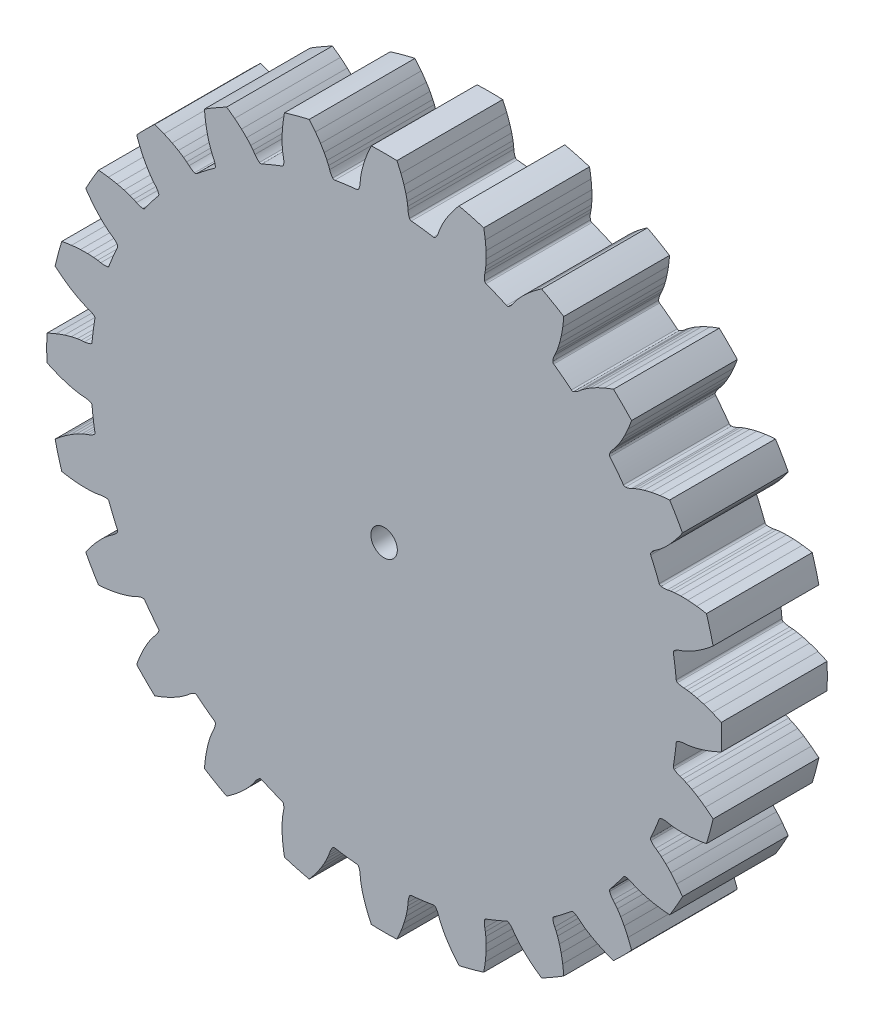
from build123d import *

# Parameters (mm, degrees)
BOSS_EXTRUDE1_DEPTH = 12.7
SKETCH2_R           = 1.5875
CUT_EXTRUDE1_DEPTH  = 59.67273613


with BuildPart() as part:
    # Model → Boss-Extrude1 (new body)
    with BuildSketch(Plane.XY):
        with BuildLine():
            ThreePointArc((34.918122358, -4.597058019), (34.999024317, -3.934019352), (35.067337394, -3.269565647))
            ThreePointArc((35.067337394, -3.269565647), (35.117289307, -3.136889034), (35.227836474, -3.048133181))
            ThreePointArc((35.227836474, -3.048133181), (35.597586296, -2.925959175), (35.983262257, -2.872149586))
            ThreePointArc((35.983262257, -2.872149586), (36.173696873, -2.859616768), (36.363582299, -2.840487209))
            ThreePointArc((36.363582299, -2.840487209), (36.599053851, -2.809299698), (36.833565008, -2.771563378))
            ThreePointArc((36.833565008, -2.771563378), (37.195949989, -2.701153106), (37.555494844, -2.617439436))
            ThreePointArc((37.555494844, -2.617439436), (37.966482977, -2.506715419), (38.373723351, -2.382915857))
            ThreePointArc((38.373723351, -2.382915857), (38.883469202, -2.208794801), (39.386594794, -2.016379586))
            ThreePointArc((39.386594794, -2.016379586), (39.934832511, -1.784794144), (40.475208291, -1.535414057))
            ThreePointArc((40.475208291, -1.535414057), (40.504320541, 0), (40.475208291, 1.535414057))
            ThreePointArc((40.475208291, 1.535414057), (39.934832515, 1.784794142), (39.386594803, 2.016379583))
            ThreePointArc((39.386594803, 2.016379583), (38.883469215, 2.208794797), (38.373723367, 2.382915852))
            ThreePointArc((38.373723367, 2.382915852), (37.966482996, 2.506715414), (37.555494865, 2.617439431))
            ThreePointArc((37.555494865, 2.617439431), (37.195950011, 2.701153102), (36.83356503, 2.771563374))
            ThreePointArc((36.83356503, 2.771563374), (36.599053872, 2.809299694), (36.363582319, 2.840487206))
            ThreePointArc((36.363582319, 2.840487206), (36.173696892, 2.859616766), (35.983262273, 2.872149585))
            ThreePointArc((35.983262273, 2.872149585), (35.597586321, 2.925959167), (35.227836504, 3.048133159))
            ThreePointArc((35.227836504, 3.048133159), (35.117289331, 3.136889003), (35.067337397, 3.269565608))
            ThreePointArc((35.067337397, 3.269565608), (34.91812236, 4.597058), (34.718672707, 5.917936879))
            ThreePointArc((34.718672707, 5.917936879), (34.732583315, 6.059021153), (34.816391973, 6.173364435))
            ThreePointArc((34.816391973, 6.173364435), (35.141921916, 6.38707376), (35.500529341, 6.538870115))
            ThreePointArc((35.500529341, 6.538870115), (35.681231323, 6.600263994), (35.859695466, 6.667887693))
            ThreePointArc((35.859695466, 6.667887693), (36.079071597, 6.758957038), (36.295825102, 6.856103477))
            ThreePointArc((36.295825102, 6.856103477), (36.627638596, 7.017906712), (36.953265565, 7.191824964))
            ThreePointArc((36.953265565, 7.191824964), (37.321592132, 7.405147707), (37.682914442, 7.630130466))
            ThreePointArc((37.682914442, 7.630130466), (38.13022528, 7.930250426), (38.56640656, 8.246327736))
            ThreePointArc((38.56640656, 8.246327736), (39.036024807, 8.611916458), (39.493443412, 8.992658669))
            ThreePointArc((39.493443412, 8.992658669), (39.124169287, 10.483289565), (38.698654612, 11.958850852))
            ThreePointArc((38.698654612, 11.958850852), (38.112147379, 12.059873974), (37.522651691, 12.141673971))
            ThreePointArc((37.522651691, 12.141673971), (36.986868971, 12.197314312), (36.449426446, 12.233570402))
            ThreePointArc((36.449426446, 12.233570402), (36.024020769, 12.247750032), (35.598379235, 12.248329665))
            ThreePointArc((35.598379235, 12.248329665), (35.229418882, 12.236133805), (34.861158351, 12.210352771))
            ThreePointArc((34.861158351, 12.210352771), (34.624871089, 12.186107303), (34.389351112, 12.155287604))
            ThreePointArc((34.389351112, 12.155287604), (34.20098478, 12.124619375), (34.013795331, 12.087437043))
            ThreePointArc((34.013795331, 12.087437043), (33.627334023, 12.039592826), (33.23856217, 12.061905546))
            ThreePointArc((33.23856217, 12.061905546), (33.108810098, 12.119025393), (33.026221003, 12.234252641))
            ThreePointArc((33.026221003, 12.234252641), (32.538510031, 13.477892133), (32.00398785, 14.702141787))
            ThreePointArc((32.00398785, 14.702141787), (31.980909169, 14.842019062), (32.032267897, 14.974157468))
            ThreePointArc((32.032267897, 14.974157468), (32.291393633, 15.264838172), (32.598494018, 15.504276623))
            ThreePointArc((32.598494018, 15.504276623), (32.757148825, 15.610347671), (32.912029648, 15.721857067))
            ThreePointArc((32.912029648, 15.721857067), (33.100360238, 15.86660202), (33.284584698, 16.01653821))
            ThreePointArc((33.284584698, 16.01653821), (33.563214162, 16.258707785), (33.832732305, 16.510978377))
            ThreePointArc((33.832732305, 16.510978377), (34.13329646, 16.812362255), (34.424077188, 17.123196008))
            ThreePointArc((34.424077188, 17.123196008), (34.778469517, 17.528862191), (35.117981453, 17.947061451))
            ThreePointArc((35.117981453, 17.947061451), (35.476976522, 18.421739186), (35.820265632, 18.907896567))
            ThreePointArc((35.820265632, 18.907896567), (35.077770552, 20.252160271), (34.284851575, 21.567311724))
            ThreePointArc((34.284851575, 21.567311724), (33.692182383, 21.513093325), (33.101601876, 21.439533344))
            ThreePointArc((33.101601876, 21.439533344), (32.569674729, 21.354607013), (32.041161348, 21.250527346))
            ThreePointArc((32.041161348, 21.250527346), (31.62658106, 21.154120727), (31.215292889, 21.044516473))
            ThreePointArc((31.215292889, 21.044516473), (30.862061076, 20.937242211), (30.513021341, 20.817026805))
            ThreePointArc((30.513021341, 20.817026805), (30.291060561, 20.732451838), (30.071542458, 20.64172524))
            ThreePointArc((30.071542458, 20.64172524), (29.897532074, 20.56334921), (29.726344447, 20.478985641))
            ThreePointArc((29.726344447, 20.478985641), (29.365434484, 20.33274813), (28.984134754, 20.253679002))
            ThreePointArc((28.984134754, 20.253679002), (28.844020171, 20.275270231), (28.734422225, 20.365195575))
            ThreePointArc((28.734422225, 20.365195575), (27.941452016, 21.440230191), (27.10828411, 22.484420029))
            ThreePointArc((27.10828411, 22.484420029), (27.049788913, 22.613557898), (27.065197699, 22.754486415))
            ThreePointArc((27.065197699, 22.754486415), (27.240260237, 23.10232909), (27.4749252, 23.413092302))
            ThreePointArc((27.4749252, 23.413092302), (27.600720768, 23.556611952), (27.721463399, 23.704407864))
            ThreePointArc((27.721463399, 23.704407864), (27.865914029, 23.892964296), (28.005054851, 24.085472333))
            ThreePointArc((28.005054851, 24.085472333), (28.211512149, 24.391504792), (28.40655425, 24.7049359))
            ThreePointArc((28.40655425, 24.7049359), (28.618873042, 25.073842099), (28.819295962, 25.449344039))
            ThreePointArc((28.819295962, 25.449344039), (29.056618531, 25.932910967), (29.276323945, 26.424732587))
            ThreePointArc((29.276323945, 26.424732587), (29.500230916, 26.976150832), (29.705995944, 27.534592561))
            ThreePointArc((29.705995944, 27.534592561), (28.640879722, 28.640879722), (27.534592561, 29.705995944))
            ThreePointArc((27.534592561, 29.705995944), (26.976150836, 29.500230918), (26.424732596, 29.276323949))
            ThreePointArc((26.424732596, 29.276323949), (25.932910979, 29.056618537), (25.449344054, 28.81929597))
            ThreePointArc((25.449344054, 28.81929597), (25.073842116, 28.618873052), (24.704935918, 28.406554261))
            ThreePointArc((24.704935918, 28.406554261), (24.39150481, 28.211512161), (24.085472352, 28.005054864))
            ThreePointArc((24.085472352, 28.005054864), (23.892964314, 27.865914042), (23.704407881, 27.721463412))
            ThreePointArc((23.704407881, 27.721463412), (23.556611966, 27.60072078), (23.413092315, 27.474925211))
            ThreePointArc((23.413092315, 27.474925211), (23.102329113, 27.24026025), (22.754486452, 27.065197706))
            ThreePointArc((22.754486452, 27.065197706), (22.613557937, 27.049788908), (22.484420059, 27.108284085))
            ThreePointArc((22.484420059, 27.108284085), (21.440230222, 27.941451993), (20.365195606, 28.734422203))
            ThreePointArc((20.365195606, 28.734422203), (20.275270245, 28.844020135), (20.253679006, 28.984134716))
            ThreePointArc((20.253679006, 28.984134716), (20.332748124, 29.365434458), (20.478985633, 29.726344432))
            ThreePointArc((20.478985633, 29.726344432), (20.563349202, 29.897532057), (20.641725231, 30.071542439))
            ThreePointArc((20.641725231, 30.071542439), (20.73245183, 30.29106054), (20.817026797, 30.51302132))
            ThreePointArc((20.817026797, 30.51302132), (20.937242204, 30.862061055), (21.044516467, 31.215292869))
            ThreePointArc((21.044516467, 31.215292869), (21.154120722, 31.626581041), (21.250527343, 32.041161331))
            ThreePointArc((21.250527343, 32.041161331), (21.354607011, 32.569674716), (21.439533342, 33.101601867))
            ThreePointArc((21.439533342, 33.101601867), (21.513093325, 33.692182378), (21.567311724, 34.284851575))
            ThreePointArc((21.567311724, 34.284851575), (20.252160271, 35.077770552), (18.907896567, 35.820265632))
            ThreePointArc((18.907896567, 35.820265632), (18.42173919, 35.476976525), (17.947061459, 35.117981459))
            ThreePointArc((17.947061459, 35.117981459), (17.528862202, 34.778469526), (17.123196021, 34.4240772))
            ThreePointArc((17.123196021, 34.4240772), (16.812362269, 34.133296474), (16.510978392, 33.83273232))
            ThreePointArc((16.510978392, 33.83273232), (16.2587078, 33.563214178), (16.016538225, 33.284584715))
            ThreePointArc((16.016538225, 33.284584715), (15.866602034, 33.100360255), (15.72185708, 32.912029664))
            ThreePointArc((15.72185708, 32.912029664), (15.610347682, 32.75714884), (15.504276633, 32.598494032))
            ThreePointArc((15.504276633, 32.598494032), (15.264838191, 32.291393651), (14.974157502, 32.032267913))
            ThreePointArc((14.974157502, 32.032267913), (14.8420191, 31.980909174), (14.702141823, 32.003987833))
            ThreePointArc((14.702141823, 32.003987833), (13.477892169, 32.538510016), (12.234252678, 33.026220989))
            ThreePointArc((12.234252678, 33.026220989), (12.119025417, 33.108810067), (12.061905559, 33.238562135))
            ThreePointArc((12.061905559, 33.238562135), (12.039592826, 33.627333997), (12.087437039, 34.013795315))
            ThreePointArc((12.087437039, 34.013795315), (12.124619372, 34.200984761), (12.155287601, 34.389351092))
            ThreePointArc((12.155287601, 34.389351092), (12.186107301, 34.624871067), (12.210352769, 34.861158328))
            ThreePointArc((12.210352769, 34.861158328), (12.236133804, 35.22941886), (12.248329664, 35.598379214))
            ThreePointArc((12.248329664, 35.598379214), (12.247750033, 36.02402075), (12.233570403, 36.449426428))
            ThreePointArc((12.233570403, 36.449426428), (12.197314313, 36.986868957), (12.141673972, 37.522651682))
            ThreePointArc((12.141673972, 37.522651682), (12.059873975, 38.112147374), (11.958850852, 38.698654612))
            ThreePointArc((11.958850852, 38.698654612), (10.483289565, 39.124169287), (8.992658669, 39.493443412))
            ThreePointArc((8.992658669, 39.493443412), (8.611916461, 39.03602481), (8.246327742, 38.566406568))
            ThreePointArc((8.246327742, 38.566406568), (7.930250433, 38.130225291), (7.630130476, 37.682914457))
            ThreePointArc((7.630130476, 37.682914457), (7.405147717, 37.321592149), (7.191824974, 36.953265583))
            ThreePointArc((7.191824974, 36.953265583), (7.017906722, 36.627638615), (6.856103487, 36.295825123))
            ThreePointArc((6.856103487, 36.295825123), (6.758957046, 36.079071617), (6.6678877, 35.859695485))
            ThreePointArc((6.6678877, 35.859695485), (6.600264, 35.681231341), (6.53887012, 35.500529357))
            ThreePointArc((6.53887012, 35.500529357), (6.387073773, 35.141921939), (6.173364465, 34.816391997))
            ThreePointArc((6.173364465, 34.816391997), (6.059021189, 34.73258333), (5.917936918, 34.7186727))
            ThreePointArc((5.917936918, 34.7186727), (4.597058039, 34.918122355), (3.269565647, 35.067337394))
            ThreePointArc((3.269565647, 35.067337394), (3.136889034, 35.117289307), (3.048133181, 35.227836474))
            ThreePointArc((3.048133181, 35.227836474), (2.925959175, 35.597586296), (2.872149586, 35.983262257))
            ThreePointArc((2.872149586, 35.983262257), (2.859616768, 36.173696873), (2.840487209, 36.363582299))
            ThreePointArc((2.840487209, 36.363582299), (2.809299698, 36.599053851), (2.771563378, 36.833565008))
            ThreePointArc((2.771563378, 36.833565008), (2.701153106, 37.195949989), (2.617439436, 37.555494844))
            ThreePointArc((2.617439436, 37.555494844), (2.506715419, 37.966482977), (2.382915857, 38.373723351))
            ThreePointArc((2.382915857, 38.373723351), (2.208794801, 38.883469202), (2.016379586, 39.386594794))
            ThreePointArc((2.016379586, 39.386594794), (1.784794144, 39.934832511), (1.535414057, 40.475208291))
            ThreePointArc((1.535414057, 40.475208291), (0, 40.504320541), (-1.535414057, 40.475208291))
            ThreePointArc((-1.535414057, 40.475208291), (-1.784794142, 39.934832515), (-2.016379583, 39.386594803))
            ThreePointArc((-2.016379583, 39.386594803), (-2.208794797, 38.883469215), (-2.382915852, 38.373723367))
            ThreePointArc((-2.382915852, 38.373723367), (-2.506715414, 37.966482996), (-2.617439431, 37.555494865))
            ThreePointArc((-2.617439431, 37.555494865), (-2.701153102, 37.195950011), (-2.771563374, 36.83356503))
            ThreePointArc((-2.771563374, 36.83356503), (-2.809299694, 36.599053872), (-2.840487206, 36.363582319))
            ThreePointArc((-2.840487206, 36.363582319), (-2.859616766, 36.173696892), (-2.872149585, 35.983262273))
            ThreePointArc((-2.872149585, 35.983262273), (-2.925959167, 35.597586321), (-3.048133159, 35.227836504))
            ThreePointArc((-3.048133159, 35.227836504), (-3.136889003, 35.117289331), (-3.269565608, 35.067337397))
            ThreePointArc((-3.269565608, 35.067337397), (-4.597058, 34.91812236), (-5.917936879, 34.718672707))
            ThreePointArc((-5.917936879, 34.718672707), (-6.059021153, 34.732583315), (-6.173364435, 34.816391973))
            ThreePointArc((-6.173364435, 34.816391973), (-6.38707376, 35.141921916), (-6.538870115, 35.500529341))
            ThreePointArc((-6.538870115, 35.500529341), (-6.600263994, 35.681231323), (-6.667887693, 35.859695466))
            ThreePointArc((-6.667887693, 35.859695466), (-6.758957038, 36.079071597), (-6.856103477, 36.295825102))
            ThreePointArc((-6.856103477, 36.295825102), (-7.017906712, 36.627638596), (-7.191824964, 36.953265565))
            ThreePointArc((-7.191824964, 36.953265565), (-7.405147707, 37.321592132), (-7.630130466, 37.682914442))
            ThreePointArc((-7.630130466, 37.682914442), (-7.930250426, 38.13022528), (-8.246327736, 38.56640656))
            ThreePointArc((-8.246327736, 38.56640656), (-8.611916458, 39.036024807), (-8.992658669, 39.493443412))
            ThreePointArc((-8.992658669, 39.493443412), (-10.483289565, 39.124169287), (-11.958850852, 38.698654612))
            ThreePointArc((-11.958850852, 38.698654612), (-12.059873974, 38.112147379), (-12.141673971, 37.522651691))
            ThreePointArc((-12.141673971, 37.522651691), (-12.197314312, 36.986868971), (-12.233570402, 36.449426446))
            ThreePointArc((-12.233570402, 36.449426446), (-12.247750032, 36.024020769), (-12.248329665, 35.598379235))
            ThreePointArc((-12.248329665, 35.598379235), (-12.236133805, 35.229418882), (-12.210352771, 34.861158351))
            ThreePointArc((-12.210352771, 34.861158351), (-12.186107303, 34.624871089), (-12.155287604, 34.389351112))
            ThreePointArc((-12.155287604, 34.389351112), (-12.124619375, 34.20098478), (-12.087437043, 34.013795331))
            ThreePointArc((-12.087437043, 34.013795331), (-12.039592826, 33.627334023), (-12.061905546, 33.23856217))
            ThreePointArc((-12.061905546, 33.23856217), (-12.119025393, 33.108810098), (-12.234252641, 33.026221003))
            ThreePointArc((-12.234252641, 33.026221003), (-13.477892133, 32.538510031), (-14.702141787, 32.00398785))
            ThreePointArc((-14.702141787, 32.00398785), (-14.842019062, 31.980909169), (-14.974157468, 32.032267897))
            ThreePointArc((-14.974157468, 32.032267897), (-15.264838172, 32.291393633), (-15.504276623, 32.598494018))
            ThreePointArc((-15.504276623, 32.598494018), (-15.610347671, 32.757148825), (-15.721857067, 32.912029648))
            ThreePointArc((-15.721857067, 32.912029648), (-15.86660202, 33.100360238), (-16.01653821, 33.284584698))
            ThreePointArc((-16.01653821, 33.284584698), (-16.258707785, 33.563214162), (-16.510978377, 33.832732305))
            ThreePointArc((-16.510978377, 33.832732305), (-16.812362255, 34.13329646), (-17.123196008, 34.424077188))
            ThreePointArc((-17.123196008, 34.424077188), (-17.528862191, 34.778469517), (-17.947061451, 35.117981453))
            ThreePointArc((-17.947061451, 35.117981453), (-18.421739186, 35.476976522), (-18.907896567, 35.820265632))
            ThreePointArc((-18.907896567, 35.820265632), (-20.252160271, 35.077770552), (-21.567311724, 34.284851575))
            ThreePointArc((-21.567311724, 34.284851575), (-21.513093325, 33.692182383), (-21.439533344, 33.101601876))
            ThreePointArc((-21.439533344, 33.101601876), (-21.354607013, 32.569674729), (-21.250527346, 32.041161348))
            ThreePointArc((-21.250527346, 32.041161348), (-21.154120727, 31.62658106), (-21.044516473, 31.215292889))
            ThreePointArc((-21.044516473, 31.215292889), (-20.937242211, 30.862061076), (-20.817026805, 30.513021341))
            ThreePointArc((-20.817026805, 30.513021341), (-20.732451838, 30.291060561), (-20.64172524, 30.071542458))
            ThreePointArc((-20.64172524, 30.071542458), (-20.56334921, 29.897532074), (-20.478985641, 29.726344447))
            ThreePointArc((-20.478985641, 29.726344447), (-20.33274813, 29.365434484), (-20.253679002, 28.984134754))
            ThreePointArc((-20.253679002, 28.984134754), (-20.275270231, 28.844020171), (-20.365195575, 28.734422225))
            ThreePointArc((-20.365195575, 28.734422225), (-21.440230191, 27.941452016), (-22.484420029, 27.10828411))
            ThreePointArc((-22.484420029, 27.10828411), (-22.613557898, 27.049788913), (-22.754486415, 27.065197699))
            ThreePointArc((-22.754486415, 27.065197699), (-23.10232909, 27.240260237), (-23.413092302, 27.4749252))
            ThreePointArc((-23.413092302, 27.4749252), (-23.556611952, 27.600720768), (-23.704407864, 27.721463399))
            ThreePointArc((-23.704407864, 27.721463399), (-23.892964296, 27.865914029), (-24.085472333, 28.005054851))
            ThreePointArc((-24.085472333, 28.005054851), (-24.391504792, 28.211512149), (-24.7049359, 28.40655425))
            ThreePointArc((-24.7049359, 28.40655425), (-25.073842099, 28.618873042), (-25.449344039, 28.819295962))
            ThreePointArc((-25.449344039, 28.819295962), (-25.932910967, 29.056618531), (-26.424732587, 29.276323945))
            ThreePointArc((-26.424732587, 29.276323945), (-26.976150832, 29.500230916), (-27.534592561, 29.705995944))
            ThreePointArc((-27.534592561, 29.705995944), (-28.640879722, 28.640879722), (-29.705995944, 27.534592561))
            ThreePointArc((-29.705995944, 27.534592561), (-29.500230918, 26.976150836), (-29.276323949, 26.424732596))
            ThreePointArc((-29.276323949, 26.424732596), (-29.056618537, 25.932910979), (-28.81929597, 25.449344054))
            ThreePointArc((-28.81929597, 25.449344054), (-28.618873052, 25.073842116), (-28.406554261, 24.704935918))
            ThreePointArc((-28.406554261, 24.704935918), (-28.211512161, 24.39150481), (-28.005054864, 24.085472352))
            ThreePointArc((-28.005054864, 24.085472352), (-27.865914042, 23.892964314), (-27.721463412, 23.704407881))
            ThreePointArc((-27.721463412, 23.704407881), (-27.60072078, 23.556611966), (-27.474925211, 23.413092315))
            ThreePointArc((-27.474925211, 23.413092315), (-27.24026025, 23.102329113), (-27.065197706, 22.754486452))
            ThreePointArc((-27.065197706, 22.754486452), (-27.049788908, 22.613557937), (-27.108284085, 22.484420059))
            ThreePointArc((-27.108284085, 22.484420059), (-27.941451993, 21.440230222), (-28.734422203, 20.365195606))
            ThreePointArc((-28.734422203, 20.365195606), (-28.844020135, 20.275270245), (-28.984134716, 20.253679006))
            ThreePointArc((-28.984134716, 20.253679006), (-29.365434458, 20.332748124), (-29.726344432, 20.478985633))
            ThreePointArc((-29.726344432, 20.478985633), (-29.897532057, 20.563349202), (-30.071542439, 20.641725231))
            ThreePointArc((-30.071542439, 20.641725231), (-30.29106054, 20.73245183), (-30.51302132, 20.817026797))
            ThreePointArc((-30.51302132, 20.817026797), (-30.862061055, 20.937242204), (-31.215292869, 21.044516467))
            ThreePointArc((-31.215292869, 21.044516467), (-31.626581041, 21.154120722), (-32.041161331, 21.250527343))
            ThreePointArc((-32.041161331, 21.250527343), (-32.569674716, 21.354607011), (-33.101601867, 21.439533342))
            ThreePointArc((-33.101601867, 21.439533342), (-33.692182378, 21.513093325), (-34.284851575, 21.567311724))
            ThreePointArc((-34.284851575, 21.567311724), (-35.077770552, 20.252160271), (-35.820265632, 18.907896567))
            ThreePointArc((-35.820265632, 18.907896567), (-35.476976525, 18.42173919), (-35.117981459, 17.947061459))
            ThreePointArc((-35.117981459, 17.947061459), (-34.778469526, 17.528862202), (-34.4240772, 17.123196021))
            ThreePointArc((-34.4240772, 17.123196021), (-34.133296474, 16.812362269), (-33.83273232, 16.510978392))
            ThreePointArc((-33.83273232, 16.510978392), (-33.563214178, 16.2587078), (-33.284584715, 16.016538225))
            ThreePointArc((-33.284584715, 16.016538225), (-33.100360255, 15.866602034), (-32.912029664, 15.72185708))
            ThreePointArc((-32.912029664, 15.72185708), (-32.75714884, 15.610347682), (-32.598494032, 15.504276633))
            ThreePointArc((-32.598494032, 15.504276633), (-32.291393651, 15.264838191), (-32.032267913, 14.974157502))
            ThreePointArc((-32.032267913, 14.974157502), (-31.980909174, 14.8420191), (-32.003987833, 14.702141823))
            ThreePointArc((-32.003987833, 14.702141823), (-32.538510016, 13.477892169), (-33.026220989, 12.234252678))
            ThreePointArc((-33.026220989, 12.234252678), (-33.108810067, 12.119025417), (-33.238562135, 12.061905559))
            ThreePointArc((-33.238562135, 12.061905559), (-33.627333997, 12.039592826), (-34.013795315, 12.087437039))
            ThreePointArc((-34.013795315, 12.087437039), (-34.200984761, 12.124619372), (-34.389351092, 12.155287601))
            ThreePointArc((-34.389351092, 12.155287601), (-34.624871067, 12.186107301), (-34.861158328, 12.210352769))
            ThreePointArc((-34.861158328, 12.210352769), (-35.22941886, 12.236133804), (-35.598379214, 12.248329664))
            ThreePointArc((-35.598379214, 12.248329664), (-36.02402075, 12.247750033), (-36.449426428, 12.233570403))
            ThreePointArc((-36.449426428, 12.233570403), (-36.986868957, 12.197314313), (-37.522651682, 12.141673972))
            ThreePointArc((-37.522651682, 12.141673972), (-38.112147374, 12.059873975), (-38.698654612, 11.958850852))
            ThreePointArc((-38.698654612, 11.958850852), (-39.124169287, 10.483289565), (-39.493443412, 8.992658669))
            ThreePointArc((-39.493443412, 8.992658669), (-39.03602481, 8.611916461), (-38.566406568, 8.246327742))
            ThreePointArc((-38.566406568, 8.246327742), (-38.130225291, 7.930250433), (-37.682914457, 7.630130476))
            ThreePointArc((-37.682914457, 7.630130476), (-37.321592149, 7.405147717), (-36.953265583, 7.191824974))
            ThreePointArc((-36.953265583, 7.191824974), (-36.627638615, 7.017906722), (-36.295825123, 6.856103487))
            ThreePointArc((-36.295825123, 6.856103487), (-36.079071617, 6.758957046), (-35.859695485, 6.6678877))
            ThreePointArc((-35.859695485, 6.6678877), (-35.681231341, 6.600264), (-35.500529357, 6.53887012))
            ThreePointArc((-35.500529357, 6.53887012), (-35.141921939, 6.387073773), (-34.816391997, 6.173364465))
            ThreePointArc((-34.816391997, 6.173364465), (-34.73258333, 6.059021189), (-34.7186727, 5.917936918))
            ThreePointArc((-34.7186727, 5.917936918), (-34.918122355, 4.597058039), (-35.067337394, 3.269565647))
            ThreePointArc((-35.067337394, 3.269565647), (-35.117289307, 3.136889034), (-35.227836474, 3.048133181))
            ThreePointArc((-35.227836474, 3.048133181), (-35.597586296, 2.925959175), (-35.983262257, 2.872149586))
            ThreePointArc((-35.983262257, 2.872149586), (-36.173696873, 2.859616768), (-36.363582299, 2.840487209))
            ThreePointArc((-36.363582299, 2.840487209), (-36.599053851, 2.809299698), (-36.833565008, 2.771563378))
            ThreePointArc((-36.833565008, 2.771563378), (-37.195949989, 2.701153106), (-37.555494844, 2.617439436))
            ThreePointArc((-37.555494844, 2.617439436), (-37.966482977, 2.506715419), (-38.373723351, 2.382915857))
            ThreePointArc((-38.373723351, 2.382915857), (-38.883469202, 2.208794801), (-39.386594794, 2.016379586))
            ThreePointArc((-39.386594794, 2.016379586), (-39.934832511, 1.784794144), (-40.475208291, 1.535414057))
            ThreePointArc((-40.475208291, 1.535414057), (-40.504320541, 0), (-40.475208291, -1.535414057))
            ThreePointArc((-40.475208291, -1.535414057), (-39.934832515, -1.784794142), (-39.386594803, -2.016379583))
            ThreePointArc((-39.386594803, -2.016379583), (-38.883469215, -2.208794797), (-38.373723367, -2.382915852))
            ThreePointArc((-38.373723367, -2.382915852), (-37.966482996, -2.506715414), (-37.555494865, -2.617439431))
            ThreePointArc((-37.555494865, -2.617439431), (-37.195950011, -2.701153102), (-36.83356503, -2.771563374))
            ThreePointArc((-36.83356503, -2.771563374), (-36.599053872, -2.809299694), (-36.363582319, -2.840487206))
            ThreePointArc((-36.363582319, -2.840487206), (-36.173696892, -2.859616766), (-35.983262273, -2.872149585))
            ThreePointArc((-35.983262273, -2.872149585), (-35.597586321, -2.925959167), (-35.227836504, -3.048133159))
            ThreePointArc((-35.227836504, -3.048133159), (-35.117289331, -3.136889003), (-35.067337397, -3.269565608))
            ThreePointArc((-35.067337397, -3.269565608), (-34.91812236, -4.597058), (-34.718672707, -5.917936879))
            ThreePointArc((-34.718672707, -5.917936879), (-34.732583315, -6.059021153), (-34.816391973, -6.173364435))
            ThreePointArc((-34.816391973, -6.173364435), (-35.141921916, -6.38707376), (-35.500529341, -6.538870115))
            ThreePointArc((-35.500529341, -6.538870115), (-35.681231323, -6.600263994), (-35.859695466, -6.667887693))
            ThreePointArc((-35.859695466, -6.667887693), (-36.079071597, -6.758957038), (-36.295825102, -6.856103477))
            ThreePointArc((-36.295825102, -6.856103477), (-36.627638596, -7.017906712), (-36.953265565, -7.191824964))
            ThreePointArc((-36.953265565, -7.191824964), (-37.321592132, -7.405147707), (-37.682914442, -7.630130466))
            ThreePointArc((-37.682914442, -7.630130466), (-38.13022528, -7.930250426), (-38.56640656, -8.246327736))
            ThreePointArc((-38.56640656, -8.246327736), (-39.036024807, -8.611916458), (-39.493443412, -8.992658669))
            ThreePointArc((-39.493443412, -8.992658669), (-39.124169287, -10.483289565), (-38.698654612, -11.958850852))
            ThreePointArc((-38.698654612, -11.958850852), (-38.112147379, -12.059873974), (-37.522651691, -12.141673971))
            ThreePointArc((-37.522651691, -12.141673971), (-36.986868971, -12.197314312), (-36.449426446, -12.233570402))
            ThreePointArc((-36.449426446, -12.233570402), (-36.024020769, -12.247750032), (-35.598379235, -12.248329665))
            ThreePointArc((-35.598379235, -12.248329665), (-35.229418882, -12.236133805), (-34.861158351, -12.210352771))
            ThreePointArc((-34.861158351, -12.210352771), (-34.624871089, -12.186107303), (-34.389351112, -12.155287604))
            ThreePointArc((-34.389351112, -12.155287604), (-34.20098478, -12.124619375), (-34.013795331, -12.087437043))
            ThreePointArc((-34.013795331, -12.087437043), (-33.627334023, -12.039592826), (-33.23856217, -12.061905546))
            ThreePointArc((-33.23856217, -12.061905546), (-33.108810098, -12.119025393), (-33.026221003, -12.234252641))
            ThreePointArc((-33.026221003, -12.234252641), (-32.538510031, -13.477892133), (-32.00398785, -14.702141787))
            ThreePointArc((-32.00398785, -14.702141787), (-31.980909169, -14.842019062), (-32.032267897, -14.974157468))
            ThreePointArc((-32.032267897, -14.974157468), (-32.291393633, -15.264838172), (-32.598494018, -15.504276623))
            ThreePointArc((-32.598494018, -15.504276623), (-32.757148825, -15.610347671), (-32.912029648, -15.721857067))
            ThreePointArc((-32.912029648, -15.721857067), (-33.100360238, -15.86660202), (-33.284584698, -16.01653821))
            ThreePointArc((-33.284584698, -16.01653821), (-33.563214162, -16.258707785), (-33.832732305, -16.510978377))
            ThreePointArc((-33.832732305, -16.510978377), (-34.13329646, -16.812362255), (-34.424077188, -17.123196008))
            ThreePointArc((-34.424077188, -17.123196008), (-34.778469517, -17.528862191), (-35.117981453, -17.947061451))
            ThreePointArc((-35.117981453, -17.947061451), (-35.476976522, -18.421739186), (-35.820265632, -18.907896567))
            ThreePointArc((-35.820265632, -18.907896567), (-35.077770552, -20.252160271), (-34.284851575, -21.567311724))
            ThreePointArc((-34.284851575, -21.567311724), (-33.692182383, -21.513093325), (-33.101601876, -21.439533344))
            ThreePointArc((-33.101601876, -21.439533344), (-32.569674729, -21.354607013), (-32.041161348, -21.250527346))
            ThreePointArc((-32.041161348, -21.250527346), (-31.62658106, -21.154120727), (-31.215292889, -21.044516473))
            ThreePointArc((-31.215292889, -21.044516473), (-30.862061076, -20.937242211), (-30.513021341, -20.817026805))
            ThreePointArc((-30.513021341, -20.817026805), (-30.291060561, -20.732451838), (-30.071542458, -20.64172524))
            ThreePointArc((-30.071542458, -20.64172524), (-29.897532074, -20.56334921), (-29.726344447, -20.478985641))
            ThreePointArc((-29.726344447, -20.478985641), (-29.365434484, -20.33274813), (-28.984134754, -20.253679002))
            ThreePointArc((-28.984134754, -20.253679002), (-28.844020171, -20.275270231), (-28.734422225, -20.365195575))
            ThreePointArc((-28.734422225, -20.365195575), (-27.941452016, -21.440230191), (-27.10828411, -22.484420029))
            ThreePointArc((-27.10828411, -22.484420029), (-27.049788913, -22.613557898), (-27.065197699, -22.754486415))
            ThreePointArc((-27.065197699, -22.754486415), (-27.240260237, -23.10232909), (-27.4749252, -23.413092302))
            ThreePointArc((-27.4749252, -23.413092302), (-27.600720768, -23.556611952), (-27.721463399, -23.704407864))
            ThreePointArc((-27.721463399, -23.704407864), (-27.865914029, -23.892964296), (-28.005054851, -24.085472333))
            ThreePointArc((-28.005054851, -24.085472333), (-28.211512149, -24.391504792), (-28.40655425, -24.7049359))
            ThreePointArc((-28.40655425, -24.7049359), (-28.618873042, -25.073842099), (-28.819295962, -25.449344039))
            ThreePointArc((-28.819295962, -25.449344039), (-29.056618531, -25.932910967), (-29.276323945, -26.424732587))
            ThreePointArc((-29.276323945, -26.424732587), (-29.500230916, -26.976150832), (-29.705995944, -27.534592561))
            ThreePointArc((-29.705995944, -27.534592561), (-28.640879722, -28.640879722), (-27.534592561, -29.705995944))
            ThreePointArc((-27.534592561, -29.705995944), (-26.976150836, -29.500230918), (-26.424732596, -29.276323949))
            ThreePointArc((-26.424732596, -29.276323949), (-25.932910979, -29.056618537), (-25.449344054, -28.81929597))
            ThreePointArc((-25.449344054, -28.81929597), (-25.073842116, -28.618873052), (-24.704935918, -28.406554261))
            ThreePointArc((-24.704935918, -28.406554261), (-24.39150481, -28.211512161), (-24.085472352, -28.005054864))
            ThreePointArc((-24.085472352, -28.005054864), (-23.892964314, -27.865914042), (-23.704407881, -27.721463412))
            ThreePointArc((-23.704407881, -27.721463412), (-23.556611966, -27.60072078), (-23.413092315, -27.474925211))
            ThreePointArc((-23.413092315, -27.474925211), (-23.102329113, -27.24026025), (-22.754486452, -27.065197706))
            ThreePointArc((-22.754486452, -27.065197706), (-22.613557937, -27.049788908), (-22.484420059, -27.108284085))
            ThreePointArc((-22.484420059, -27.108284085), (-21.440230222, -27.941451993), (-20.365195606, -28.734422203))
            ThreePointArc((-20.365195606, -28.734422203), (-20.275270245, -28.844020135), (-20.253679006, -28.984134716))
            ThreePointArc((-20.253679006, -28.984134716), (-20.332748124, -29.365434458), (-20.478985633, -29.726344432))
            ThreePointArc((-20.478985633, -29.726344432), (-20.563349202, -29.897532057), (-20.641725231, -30.071542439))
            ThreePointArc((-20.641725231, -30.071542439), (-20.73245183, -30.29106054), (-20.817026797, -30.51302132))
            ThreePointArc((-20.817026797, -30.51302132), (-20.937242204, -30.862061055), (-21.044516467, -31.215292869))
            ThreePointArc((-21.044516467, -31.215292869), (-21.154120722, -31.626581041), (-21.250527343, -32.041161331))
            ThreePointArc((-21.250527343, -32.041161331), (-21.354607011, -32.569674716), (-21.439533342, -33.101601867))
            ThreePointArc((-21.439533342, -33.101601867), (-21.513093325, -33.692182378), (-21.567311724, -34.284851575))
            ThreePointArc((-21.567311724, -34.284851575), (-20.252160271, -35.077770552), (-18.907896567, -35.820265632))
            ThreePointArc((-18.907896567, -35.820265632), (-18.42173919, -35.476976525), (-17.947061459, -35.117981459))
            ThreePointArc((-17.947061459, -35.117981459), (-17.528862202, -34.778469526), (-17.123196021, -34.4240772))
            ThreePointArc((-17.123196021, -34.4240772), (-16.812362269, -34.133296474), (-16.510978392, -33.83273232))
            ThreePointArc((-16.510978392, -33.83273232), (-16.2587078, -33.563214178), (-16.016538225, -33.284584715))
            ThreePointArc((-16.016538225, -33.284584715), (-15.866602034, -33.100360255), (-15.72185708, -32.912029664))
            ThreePointArc((-15.72185708, -32.912029664), (-15.610347682, -32.75714884), (-15.504276633, -32.598494032))
            ThreePointArc((-15.504276633, -32.598494032), (-15.264838191, -32.291393651), (-14.974157502, -32.032267913))
            ThreePointArc((-14.974157502, -32.032267913), (-14.8420191, -31.980909174), (-14.702141823, -32.003987833))
            ThreePointArc((-14.702141823, -32.003987833), (-13.477892169, -32.538510016), (-12.234252678, -33.026220989))
            ThreePointArc((-12.234252678, -33.026220989), (-12.119025417, -33.108810067), (-12.061905559, -33.238562135))
            ThreePointArc((-12.061905559, -33.238562135), (-12.039592826, -33.627333997), (-12.087437039, -34.013795315))
            ThreePointArc((-12.087437039, -34.013795315), (-12.124619372, -34.200984761), (-12.155287601, -34.389351092))
            ThreePointArc((-12.155287601, -34.389351092), (-12.186107301, -34.624871067), (-12.210352769, -34.861158328))
            ThreePointArc((-12.210352769, -34.861158328), (-12.236133804, -35.22941886), (-12.248329664, -35.598379214))
            ThreePointArc((-12.248329664, -35.598379214), (-12.247750033, -36.02402075), (-12.233570403, -36.449426428))
            ThreePointArc((-12.233570403, -36.449426428), (-12.197314313, -36.986868957), (-12.141673972, -37.522651682))
            ThreePointArc((-12.141673972, -37.522651682), (-12.059873975, -38.112147374), (-11.958850852, -38.698654612))
            ThreePointArc((-11.958850852, -38.698654612), (-10.483289565, -39.124169287), (-8.992658669, -39.493443412))
            ThreePointArc((-8.992658669, -39.493443412), (-8.611916461, -39.03602481), (-8.246327742, -38.566406568))
            ThreePointArc((-8.246327742, -38.566406568), (-7.930250433, -38.130225291), (-7.630130476, -37.682914457))
            ThreePointArc((-7.630130476, -37.682914457), (-7.405147717, -37.321592149), (-7.191824974, -36.953265583))
            ThreePointArc((-7.191824974, -36.953265583), (-7.017906722, -36.627638615), (-6.856103487, -36.295825123))
            ThreePointArc((-6.856103487, -36.295825123), (-6.758957046, -36.079071617), (-6.6678877, -35.859695485))
            ThreePointArc((-6.6678877, -35.859695485), (-6.600264, -35.681231341), (-6.53887012, -35.500529357))
            ThreePointArc((-6.53887012, -35.500529357), (-6.387073773, -35.141921939), (-6.173364465, -34.816391997))
            ThreePointArc((-6.173364465, -34.816391997), (-6.059021189, -34.73258333), (-5.917936918, -34.7186727))
            ThreePointArc((-5.917936918, -34.7186727), (-4.597058039, -34.918122355), (-3.269565647, -35.067337394))
            ThreePointArc((-3.269565647, -35.067337394), (-3.136889034, -35.117289307), (-3.048133181, -35.227836474))
            ThreePointArc((-3.048133181, -35.227836474), (-2.925959175, -35.597586296), (-2.872149586, -35.983262257))
            ThreePointArc((-2.872149586, -35.983262257), (-2.859616768, -36.173696873), (-2.840487209, -36.363582299))
            ThreePointArc((-2.840487209, -36.363582299), (-2.809299698, -36.599053851), (-2.771563378, -36.833565008))
            ThreePointArc((-2.771563378, -36.833565008), (-2.701153106, -37.195949989), (-2.617439436, -37.555494844))
            ThreePointArc((-2.617439436, -37.555494844), (-2.506715419, -37.966482977), (-2.382915857, -38.373723351))
            ThreePointArc((-2.382915857, -38.373723351), (-2.208794801, -38.883469202), (-2.016379586, -39.386594794))
            ThreePointArc((-2.016379586, -39.386594794), (-1.784794144, -39.934832511), (-1.535414057, -40.475208291))
            ThreePointArc((-1.535414057, -40.475208291), (0, -40.504320541), (1.535414057, -40.475208291))
            ThreePointArc((1.535414057, -40.475208291), (1.784794142, -39.934832515), (2.016379583, -39.386594803))
            ThreePointArc((2.016379583, -39.386594803), (2.208794797, -38.883469215), (2.382915852, -38.373723367))
            ThreePointArc((2.382915852, -38.373723367), (2.506715414, -37.966482996), (2.617439431, -37.555494865))
            ThreePointArc((2.617439431, -37.555494865), (2.701153102, -37.195950011), (2.771563374, -36.83356503))
            ThreePointArc((2.771563374, -36.83356503), (2.809299694, -36.599053872), (2.840487206, -36.363582319))
            ThreePointArc((2.840487206, -36.363582319), (2.859616766, -36.173696892), (2.872149585, -35.983262273))
            ThreePointArc((2.872149585, -35.983262273), (2.925959167, -35.597586321), (3.048133159, -35.227836504))
            ThreePointArc((3.048133159, -35.227836504), (3.136889003, -35.117289331), (3.269565608, -35.067337397))
            ThreePointArc((3.269565608, -35.067337397), (4.597058, -34.91812236), (5.917936879, -34.718672707))
            ThreePointArc((5.917936879, -34.718672707), (6.059021153, -34.732583315), (6.173364435, -34.816391973))
            ThreePointArc((6.173364435, -34.816391973), (6.38707376, -35.141921916), (6.538870115, -35.500529341))
            ThreePointArc((6.538870115, -35.500529341), (6.600263994, -35.681231323), (6.667887693, -35.859695466))
            ThreePointArc((6.667887693, -35.859695466), (6.758957038, -36.079071597), (6.856103477, -36.295825102))
            ThreePointArc((6.856103477, -36.295825102), (7.017906712, -36.627638596), (7.191824964, -36.953265565))
            ThreePointArc((7.191824964, -36.953265565), (7.405147707, -37.321592132), (7.630130466, -37.682914442))
            ThreePointArc((7.630130466, -37.682914442), (7.930250426, -38.13022528), (8.246327736, -38.56640656))
            ThreePointArc((8.246327736, -38.56640656), (8.611916458, -39.036024807), (8.992658669, -39.493443412))
            ThreePointArc((8.992658669, -39.493443412), (10.483289565, -39.124169287), (11.958850852, -38.698654612))
            ThreePointArc((11.958850852, -38.698654612), (12.059873974, -38.112147379), (12.141673971, -37.522651691))
            ThreePointArc((12.141673971, -37.522651691), (12.197314312, -36.986868971), (12.233570402, -36.449426446))
            ThreePointArc((12.233570402, -36.449426446), (12.247750032, -36.024020769), (12.248329665, -35.598379235))
            ThreePointArc((12.248329665, -35.598379235), (12.236133805, -35.229418882), (12.210352771, -34.861158351))
            ThreePointArc((12.210352771, -34.861158351), (12.186107303, -34.624871089), (12.155287604, -34.389351112))
            ThreePointArc((12.155287604, -34.389351112), (12.124619375, -34.20098478), (12.087437043, -34.013795331))
            ThreePointArc((12.087437043, -34.013795331), (12.039592826, -33.627334023), (12.061905546, -33.23856217))
            ThreePointArc((12.061905546, -33.23856217), (12.119025393, -33.108810098), (12.234252641, -33.026221003))
            ThreePointArc((12.234252641, -33.026221003), (13.477892133, -32.538510031), (14.702141787, -32.00398785))
            ThreePointArc((14.702141787, -32.00398785), (14.842019062, -31.980909169), (14.974157468, -32.032267897))
            ThreePointArc((14.974157468, -32.032267897), (15.264838172, -32.291393633), (15.504276623, -32.598494018))
            ThreePointArc((15.504276623, -32.598494018), (15.610347671, -32.757148825), (15.721857067, -32.912029648))
            ThreePointArc((15.721857067, -32.912029648), (15.86660202, -33.100360238), (16.01653821, -33.284584698))
            ThreePointArc((16.01653821, -33.284584698), (16.258707785, -33.563214162), (16.510978377, -33.832732305))
            ThreePointArc((16.510978377, -33.832732305), (16.812362255, -34.13329646), (17.123196008, -34.424077188))
            ThreePointArc((17.123196008, -34.424077188), (17.528862191, -34.778469517), (17.947061451, -35.117981453))
            ThreePointArc((17.947061451, -35.117981453), (18.421739186, -35.476976522), (18.907896567, -35.820265632))
            ThreePointArc((18.907896567, -35.820265632), (20.252160271, -35.077770552), (21.567311724, -34.284851575))
            ThreePointArc((21.567311724, -34.284851575), (21.513093325, -33.692182383), (21.439533344, -33.101601876))
            ThreePointArc((21.439533344, -33.101601876), (21.354607013, -32.569674729), (21.250527346, -32.041161348))
            ThreePointArc((21.250527346, -32.041161348), (21.154120727, -31.62658106), (21.044516473, -31.215292889))
            ThreePointArc((21.044516473, -31.215292889), (20.937242211, -30.862061076), (20.817026805, -30.513021341))
            ThreePointArc((20.817026805, -30.513021341), (20.732451838, -30.291060561), (20.64172524, -30.071542458))
            ThreePointArc((20.64172524, -30.071542458), (20.56334921, -29.897532074), (20.478985641, -29.726344447))
            ThreePointArc((20.478985641, -29.726344447), (20.33274813, -29.365434484), (20.253679002, -28.984134754))
            ThreePointArc((20.253679002, -28.984134754), (20.275270231, -28.844020171), (20.365195575, -28.734422225))
            ThreePointArc((20.365195575, -28.734422225), (21.440230191, -27.941452016), (22.484420029, -27.10828411))
            ThreePointArc((22.484420029, -27.10828411), (22.613557898, -27.049788913), (22.754486415, -27.065197699))
            ThreePointArc((22.754486415, -27.065197699), (23.10232909, -27.240260237), (23.413092302, -27.4749252))
            ThreePointArc((23.413092302, -27.4749252), (23.556611952, -27.600720768), (23.704407864, -27.721463399))
            ThreePointArc((23.704407864, -27.721463399), (23.892964296, -27.865914029), (24.085472333, -28.005054851))
            ThreePointArc((24.085472333, -28.005054851), (24.391504792, -28.211512149), (24.7049359, -28.40655425))
            ThreePointArc((24.7049359, -28.40655425), (25.073842099, -28.618873042), (25.449344039, -28.819295962))
            ThreePointArc((25.449344039, -28.819295962), (25.932910967, -29.056618531), (26.424732587, -29.276323945))
            ThreePointArc((26.424732587, -29.276323945), (26.976150832, -29.500230916), (27.534592561, -29.705995944))
            ThreePointArc((27.534592561, -29.705995944), (28.640879722, -28.640879722), (29.705995944, -27.534592561))
            ThreePointArc((29.705995944, -27.534592561), (29.500230918, -26.976150836), (29.276323949, -26.424732596))
            ThreePointArc((29.276323949, -26.424732596), (29.056618537, -25.932910979), (28.81929597, -25.449344054))
            ThreePointArc((28.81929597, -25.449344054), (28.618873052, -25.073842116), (28.406554261, -24.704935918))
            ThreePointArc((28.406554261, -24.704935918), (28.211512161, -24.39150481), (28.005054864, -24.085472352))
            ThreePointArc((28.005054864, -24.085472352), (27.865914042, -23.892964314), (27.721463412, -23.704407881))
            ThreePointArc((27.721463412, -23.704407881), (27.60072078, -23.556611966), (27.474925211, -23.413092315))
            ThreePointArc((27.474925211, -23.413092315), (27.24026025, -23.102329113), (27.065197706, -22.754486452))
            ThreePointArc((27.065197706, -22.754486452), (27.049788908, -22.613557937), (27.108284085, -22.484420059))
            ThreePointArc((27.108284085, -22.484420059), (27.941451993, -21.440230222), (28.734422203, -20.365195606))
            ThreePointArc((28.734422203, -20.365195606), (28.844020135, -20.275270245), (28.984134716, -20.253679006))
            ThreePointArc((28.984134716, -20.253679006), (29.365434458, -20.332748124), (29.726344432, -20.478985633))
            ThreePointArc((29.726344432, -20.478985633), (29.897532057, -20.563349202), (30.071542439, -20.641725231))
            ThreePointArc((30.071542439, -20.641725231), (30.29106054, -20.73245183), (30.51302132, -20.817026797))
            ThreePointArc((30.51302132, -20.817026797), (30.862061055, -20.937242204), (31.215292869, -21.044516467))
            ThreePointArc((31.215292869, -21.044516467), (31.626581041, -21.154120722), (32.041161331, -21.250527343))
            ThreePointArc((32.041161331, -21.250527343), (32.569674716, -21.354607011), (33.101601867, -21.439533342))
            ThreePointArc((33.101601867, -21.439533342), (33.692182378, -21.513093325), (34.284851575, -21.567311724))
            ThreePointArc((34.284851575, -21.567311724), (35.077770552, -20.252160271), (35.820265632, -18.907896567))
            ThreePointArc((35.820265632, -18.907896567), (35.476976525, -18.42173919), (35.117981459, -17.947061459))
            ThreePointArc((35.117981459, -17.947061459), (34.778469526, -17.528862202), (34.4240772, -17.123196021))
            ThreePointArc((34.4240772, -17.123196021), (34.133296474, -16.812362269), (33.83273232, -16.510978392))
            ThreePointArc((33.83273232, -16.510978392), (33.563214178, -16.2587078), (33.284584715, -16.016538225))
            ThreePointArc((33.284584715, -16.016538225), (33.100360255, -15.866602034), (32.912029664, -15.72185708))
            ThreePointArc((32.912029664, -15.72185708), (32.75714884, -15.610347682), (32.598494032, -15.504276633))
            ThreePointArc((32.598494032, -15.504276633), (32.291393651, -15.264838191), (32.032267913, -14.974157502))
            ThreePointArc((32.032267913, -14.974157502), (31.980909174, -14.8420191), (32.003987833, -14.702141823))
            ThreePointArc((32.003987833, -14.702141823), (32.538510016, -13.477892169), (33.026220989, -12.234252678))
            ThreePointArc((33.026220989, -12.234252678), (33.108810067, -12.119025417), (33.238562135, -12.061905559))
            ThreePointArc((33.238562135, -12.061905559), (33.627333997, -12.039592826), (34.013795315, -12.087437039))
            ThreePointArc((34.013795315, -12.087437039), (34.200984761, -12.124619372), (34.389351092, -12.155287601))
            ThreePointArc((34.389351092, -12.155287601), (34.624871067, -12.186107301), (34.861158328, -12.210352769))
            ThreePointArc((34.861158328, -12.210352769), (35.22941886, -12.236133804), (35.598379214, -12.248329664))
            ThreePointArc((35.598379214, -12.248329664), (36.02402075, -12.247750033), (36.449426428, -12.233570403))
            ThreePointArc((36.449426428, -12.233570403), (36.986868957, -12.197314313), (37.522651682, -12.141673972))
            ThreePointArc((37.522651682, -12.141673972), (38.112147374, -12.059873975), (38.698654612, -11.958850852))
            ThreePointArc((38.698654612, -11.958850852), (39.124169287, -10.483289565), (39.493443412, -8.992658669))
            ThreePointArc((39.493443412, -8.992658669), (39.03602481, -8.611916461), (38.566406568, -8.246327742))
            ThreePointArc((38.566406568, -8.246327742), (38.130225291, -7.930250433), (37.682914457, -7.630130476))
            ThreePointArc((37.682914457, -7.630130476), (37.321592149, -7.405147717), (36.953265583, -7.191824974))
            ThreePointArc((36.953265583, -7.191824974), (36.627638615, -7.017906722), (36.295825123, -6.856103487))
            ThreePointArc((36.295825123, -6.856103487), (36.079071617, -6.758957046), (35.859695485, -6.6678877))
            ThreePointArc((35.859695485, -6.6678877), (35.681231341, -6.600264), (35.500529357, -6.53887012))
            ThreePointArc((35.500529357, -6.53887012), (35.141921939, -6.387073773), (34.816391997, -6.173364465))
            ThreePointArc((34.816391997, -6.173364465), (34.73258333, -6.059021189), (34.7186727, -5.917936918))
            ThreePointArc((34.7186727, -5.917936918), (34.824660612, -5.25844318), (34.918122358, -4.597058019))
        make_face()
    extrude(amount=BOSS_EXTRUDE1_DEPTH)

    # Sketch2 → Cut-Extrude1 (cut, through all)
    with BuildSketch(Plane.XY.offset(12.7)):
        Circle(SKETCH2_R)
    extrude(amount=-CUT_EXTRUDE1_DEPTH, mode=Mode.SUBTRACT)


solid = part.part
